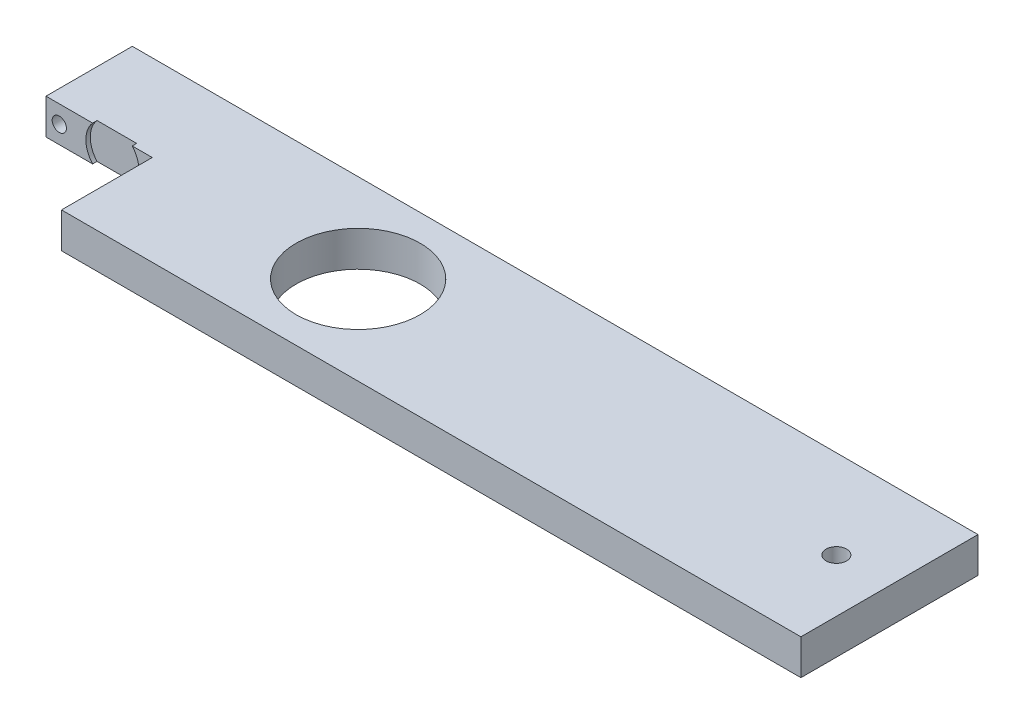
from build123d import *

# Parameters (mm, degrees)
BOSS_EXTRUDE1_DEPTH    = 12.7
SKETCH2_R              = 22.225
CUT_EXTRUDE1_DEPTH     = 194.544833307
SKETCH4_R              = 3.683
CUT_EXTRUDE3_DEPTH     = 194.544833307
F_10_CLEARANCE_HOLE1_D = 5.1054
SKETCH7_R              = 9.525
CUT_EXTRUDE4_DEPTH     = 1.5875


with BuildPart() as part:
    # Sketch1 → Boss-Extrude1 (new body)
    with BuildSketch(Plane(origin=(0, 0, 0), x_dir=(1, 0, 0), z_dir=(0, 1, 0))):
        Polygon((-112.7125, 31.75), (190.5, 31.75), (190.5, -31.75), (-74.6125, -31.75), (-74.6125, 0.79375), (-76.2, 0.79375), (-112.7125, 0.79375), align=None)
    extrude(amount=BOSS_EXTRUDE1_DEPTH)

    # Sketch2 → Cut-Extrude1 (cut, through all)
    with BuildSketch(Plane(origin=(0, 12.7, 0), x_dir=(1, 0, 0), z_dir=(0, 1, 0))):
        Circle(SKETCH2_R)
    extrude(amount=-CUT_EXTRUDE1_DEPTH, mode=Mode.SUBTRACT)

    # Sketch4 → Cut-Extrude3 (cut, through all)
    with BuildSketch(Plane(origin=(0, 12.7, 0), x_dir=(1, 0, 0), z_dir=(0, 1, 0))):
        with Locations((171.45, 0)):
            Circle(SKETCH4_R)
    extrude(amount=-CUT_EXTRUDE3_DEPTH, mode=Mode.SUBTRACT)

    # #10 Clearance Hole1 (through all)
    with Locations(Plane(origin=(0, 0, -31.75), x_dir=(-1, 0, 0), z_dir=(0, 0, -1))):
        with Locations((107.95, 6.35)):
            Hole(F_10_CLEARANCE_HOLE1_D / 2)

    # Sketch7 → Cut-Extrude4 (cut)
    with BuildSketch(Plane.XY.offset(-0.79375)):
        with Locations((-88.9, 6.35)):
            Circle(SKETCH7_R)
    extrude(amount=-CUT_EXTRUDE4_DEPTH, mode=Mode.SUBTRACT)


solid = part.part
